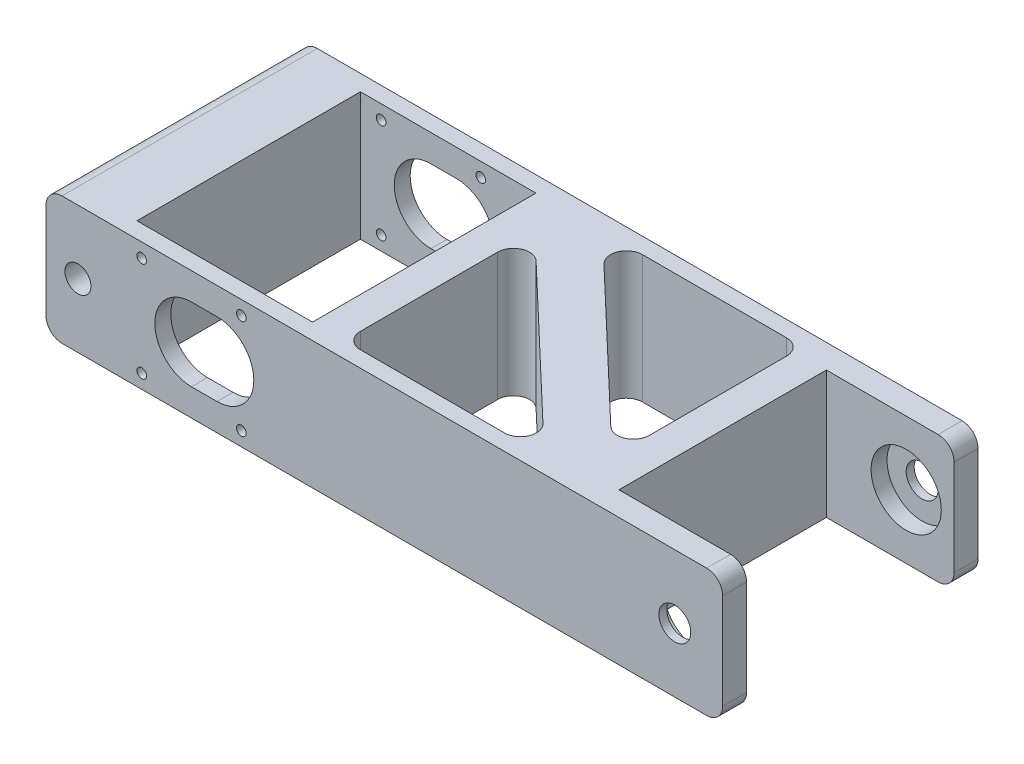
from build123d import *

# Parameters (mm, degrees)
SKETCH1_W               = 212
SKETCH1_H               = 40
SKETCH1_R               = 1.5
SKETCH1_R_2             = 4.075
SKETCH1_R_3             = 5
BOSS_EXTRUDE1_DEPTH     = 40
CUT_EXTRUDE3_DEPTH      = 116.047816146
CUT_EXTRUDE3_DEPTH_BACK = 116.047816146
SKETCH2_W               = 55
SKETCH2_H               = 70
SKETCH2_W_2             = 40
SKETCH2_H_2             = 65
FILLET1_R               = 5
FILLET2_R               = 5
SKETCH4_R               = 11
CUT_EXTRUDE4_DEPTH      = 37.5


with BuildPart() as part:
    # Sketch1 → Boss-Extrude1 (new, symmetric)
    with BuildSketch(Plane.XY):
        Rectangle(SKETCH1_W, SKETCH1_H)
        with Locations((-76, -15.6)):
            Circle(SKETCH1_R, mode=Mode.SUBTRACT)
        with Locations((-44.8, -15.6)):
            Circle(SKETCH1_R, mode=Mode.SUBTRACT)
        with Locations((-96, 0)):
            Circle(SKETCH1_R_2, mode=Mode.SUBTRACT)
        with BuildLine():
            ThreePointArc((-60.4, -11.5), (-71.9, 0), (-60.4, 11.5))
            Line((-60.4, 11.5), (-52.4, 11.5))
            ThreePointArc((-52.4, 11.5), (-40.9, 0), (-52.4, -11.5))
            Line((-52.4, -11.5), (-60.4, -11.5))
        make_face(mode=Mode.SUBTRACT)
        with Locations((-76, 15.6)):
            Circle(SKETCH1_R, mode=Mode.SUBTRACT)
        with Locations((-44.8, 15.6)):
            Circle(SKETCH1_R, mode=Mode.SUBTRACT)
        with Locations((91, 0)):
            Circle(SKETCH1_R_3, mode=Mode.SUBTRACT)
    extrude(amount=BOSS_EXTRUDE1_DEPTH, both=True)

    # Sketch2 → Cut-Extrude3 (cut, two sides: drawn at the far end of the back side and taken through both)
    with BuildSketch(Plane(origin=(0, 0, 0), x_dir=(1, 0, 0), z_dir=(0, 1, 0)).offset(-CUT_EXTRUDE3_DEPTH_BACK)):
        with Locations((-55, 0)):
            Rectangle(SKETCH2_W, SKETCH2_H)
        Polygon((-17.5, 24.642857143), (45.125, -35), (-17.5, -35), align=None)
        with Locations((86, 0)):
            Rectangle(SKETCH2_W_2, SKETCH2_H_2)
        Polygon((-6.625, 35), (56, -24.642857143), (56, 35), align=None)
    extrude(amount=CUT_EXTRUDE3_DEPTH + CUT_EXTRUDE3_DEPTH_BACK, mode=Mode.SUBTRACT)

    # Fillet1
    fillet1_edges = [part.edges().sort_by_distance(p)[0] for p in [
        (45.125, 0, 35),
        (-17.5, 0, 35),
        (56, 0, 24.642857143),
        (56, 0, -35),
        (-6.625, 0, -35),
        (-17.5, 0, -24.642857143),
    ]]
    fillet(fillet1_edges, radius=FILLET1_R)

    # Fillet2
    fillet2_edges = [part.edges().sort_by_distance(p)[0] for p in [
        (-106, 20, 0),
        (-106, -20, 0),
        (106, 20, 36.25),
        (106, -20, 36.25),
        (106, 20, -36.25),
        (106, -20, -36.25),
    ]]
    fillet(fillet2_edges, radius=FILLET2_R)

    # Sketch4 → Cut-Extrude4 (cut, symmetric)
    with BuildSketch(Plane.XY):
        with Locations((91, 0)):
            Circle(SKETCH4_R)
    extrude(amount=CUT_EXTRUDE4_DEPTH, both=True, mode=Mode.SUBTRACT)


solid = part.part
